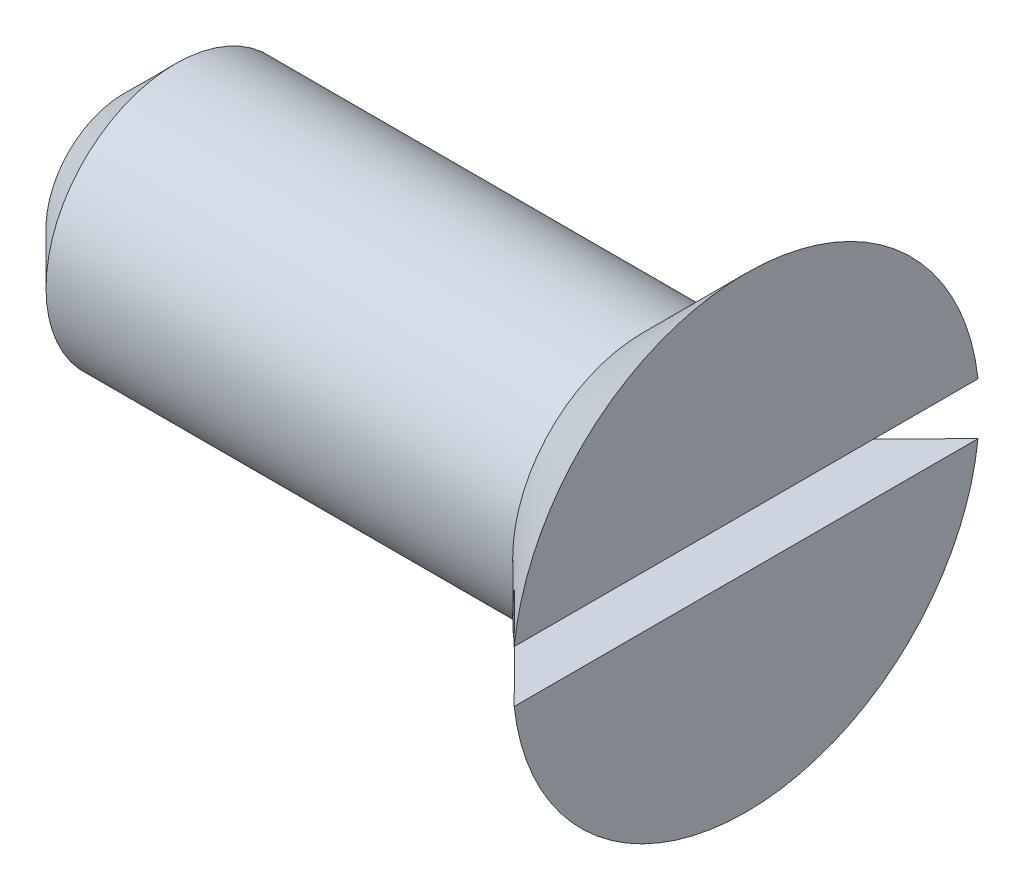
from build123d import *

# Parameters (mm, degrees)
CHAMFER_1_SIZE      = 1
SKETCH_2_W          = 9.657524734
SKETCH_2_H          = 1
CUT_EXTRUDE_1_DEPTH = 1


with BuildPart() as part:
    # Эскиз1 → Повернуть1 (revolve)
    with BuildSketch(Plane(origin=(0, 0, 0), x_dir=(1, 0, 0), z_dir=(0, 1, 0))):
        Polygon((0, 0), (12, 0), (12, 4.5), (10, 2.5), (0, 2.5), align=None)
    revolve(axis=Axis((0, 0, 0), (1, 0, 0)))

    # Фаска1
    chamfer_1_edges = [part.edges().sort_by_distance(p)[0] for p in [
        (0, 0, 2.5),
    ]]
    chamfer(chamfer_1_edges, length=CHAMFER_1_SIZE)

    # Эскиз2 → Вырез-Вытянуть1 (cut)
    with BuildSketch(Plane(origin=(12, 0, 0), x_dir=(0, 0, -1), z_dir=(1, 0, 0))):
        Rectangle(SKETCH_2_W, SKETCH_2_H)
    extrude(amount=-CUT_EXTRUDE_1_DEPTH, mode=Mode.SUBTRACT)


solid = part.part
